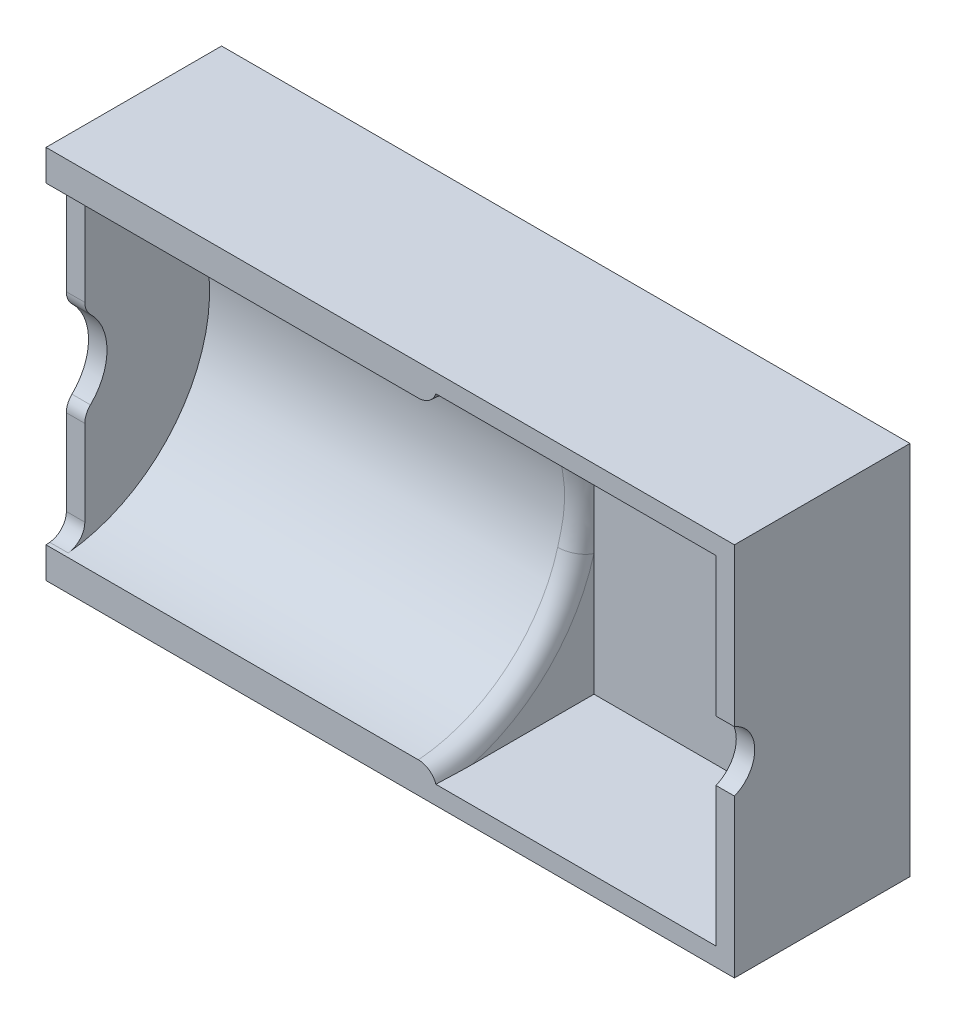
from build123d import *

# Parameters (mm, degrees)
BOSS_EXTRUDE1_DEPTH      = 2
BOSS_EXTRUDE1_DEPTH_BACK = 28.2
BOSS_EXTRUDE2_DEPTH      = 40.3
BOSS_EXTRUDE3_DEPTH      = 2
BOSS_EXTRUDE4_DEPTH      = 2
FILLET1_R                = 2
FILLET2_R                = 2


with BuildPart() as part:
    # Sketch1 → Boss-Extrude1 (new, two sides: drawn at the far end of the back side and taken through both)
    with BuildSketch(Plane.YZ.offset(-BOSS_EXTRUDE1_DEPTH_BACK)):
        Polygon((-18.3, -1.3), (-18.3, -18.3), (18.3, -18.3), (18.3, -1.3), (20.3, -1.3), (20.3, -20.3), (-20.3, -20.3), (-20.3, -1.3), align=None)
    extrude(amount=BOSS_EXTRUDE1_DEPTH + BOSS_EXTRUDE1_DEPTH_BACK)

    # Sketch2 → Boss-Extrude2 (add)
    with BuildSketch(Plane(origin=(-28.2, 0, 0), x_dir=(0, -1, 0), z_dir=(-1, 0, 0))):
        with BuildLine():
            Line((-18.3, -1.3), (-16.950221237, -1.3))
            ThreePointArc((-16.950221237, -1.3), (0, -17), (16.950221237, -1.3))
            Line((16.950221237, -1.3), (18.3, -1.3))
            Line((18.3, -1.3), (20.3, -1.3))
            Line((20.3, -1.3), (20.3, -20.3))
            Line((20.3, -20.3), (-20.3, -20.3))
            Line((-20.3, -20.3), (-20.3, -1.3))
            Line((-20.3, -1.3), (-18.3, -1.3))
        make_face()
    extrude(amount=BOSS_EXTRUDE2_DEPTH)

    # Sketch3 → Boss-Extrude3 (add)
    with BuildSketch(Plane.YZ.offset(2)):
        with BuildLine():
            Line((3.249615362, -1.3), (20.3, -1.3))
            Line((20.3, -1.3), (20.3, -20.3))
            Line((20.3, -20.3), (-20.3, -20.3))
            Line((-20.3, -20.3), (-20.3, -1.3))
            Line((-20.3, -1.3), (-3.249615362, -1.3))
            ThreePointArc((-3.249615362, -1.3), (0, -3.5), (3.249615362, -1.3))
        make_face()
    extrude(amount=BOSS_EXTRUDE3_DEPTH)

    # Sketch4 → Boss-Extrude4 (add)
    with BuildSketch(Plane(origin=(-68.5, 0, 0), x_dir=(0, -1, 0), z_dir=(-1, 0, 0))):
        with BuildLine():
            Line((-20.3, -1.3), (-20.3, -20.3))
            Line((-20.3, -20.3), (20.3, -20.3))
            Line((20.3, -20.3), (20.3, -1.3))
            Line((20.3, -1.3), (16.950221237, -1.3))
            ThreePointArc((16.950221237, -1.3), (16.829001324, -2.405143328), (16.63580476, -3.5))
            Line((16.63580476, -3.5), (4.749736835, -3.5))
            ThreePointArc((4.749736835, -3.5), (0, -5.9), (-4.749736835, -3.5))
            Line((-4.749736835, -3.5), (-16.63580476, -3.5))
            ThreePointArc((-16.63580476, -3.5), (-16.829001324, -2.405143328), (-16.950221237, -1.3))
            Line((-16.950221237, -1.3), (-20.3, -1.3))
        make_face()
    extrude(amount=BOSS_EXTRUDE4_DEPTH)

    # Fillet1
    fillet1_edges = [part.edges().sort_by_distance(p)[0] for p in [
        (-28.2, 0, -17),
    ]]
    fillet(fillet1_edges, radius=FILLET1_R)

    # Fillet2
    # the kernel refuses this fillet: 2 mm, written as the material it adds along each edge
    with BuildSketch(Plane(origin=(-68.5, -16.63580476, -3.5), x_dir=(0, -0.15316112796135575, 0.9882012289415578), z_dir=(-1, 0, 0))) as fillet2_piece_1:
        with BuildLine():
            CenterArc((1.714344809, 1.997127842), FILLET2_R, 188.810163249, 84.260829523)
            Line((-0.262057649, 1.690805586), (0, 0))
            ThreePointArc((0, 0), (0.91074568, -0.024413344), (1.82149136, 0))
        make_face()
    extrude(amount=2)
    with BuildSketch(Plane(origin=(-68.5, 16.63580476, -3.5), x_dir=(0, 0.15316112796135792, 0.9882012289415576), z_dir=(-1, 0, 0))) as fillet2_piece_2:
        with BuildLine():
            CenterArc((1.714344809, -1.997127842), FILLET2_R, 86.929007228, 84.260829523)
            Line((-0.262057649, -1.690805586), (0, 0))
            ThreePointArc((0, 0), (0.91074568, 0.024413344), (1.82149136, 0))
        make_face()
    extrude(amount=2)
    # the kernel refuses this fillet: 2 mm, written as the material it takes off along each edge
    with BuildSketch(Plane(origin=(-66.196895208, -4.749736835, -3.5), x_dir=(0, 0.6461838477214604, -0.7631817836819014), z_dir=(-1, 0, 0))) as fillet2_2_piece_1:
        with BuildLine():
            CenterArc((0.931071921, 1.995442745), FILLET2_R, 220.254494439, 45.876878938)
            Line((-0.595291646, 0.703075049), (0, 0))
            ThreePointArc((0, 0), (0.398066981, 0.013443903), (0.796133961, 0))
        make_face()
    extrude(amount=6.606209583, mode=Mode.SUBTRACT)
    with BuildSketch(Plane(origin=(-66.196895208, 4.749736835, -3.5), x_dir=(0, 1, 0), z_dir=(-1, 0, 0))) as fillet2_2_piece_2:
        with BuildLine():
            CenterArc((0.921241917, 2), FILLET2_R, 224.123121062, 45.876878938)
            ThreePointArc((-0.514448906, 0.607594937), (-0.246964311, 0.312484702), (0, 0))
            Line((0, 0), (0.921241917, 0))
        make_face()
    extrude(amount=6.606209583, mode=Mode.SUBTRACT)


solid = part.part
